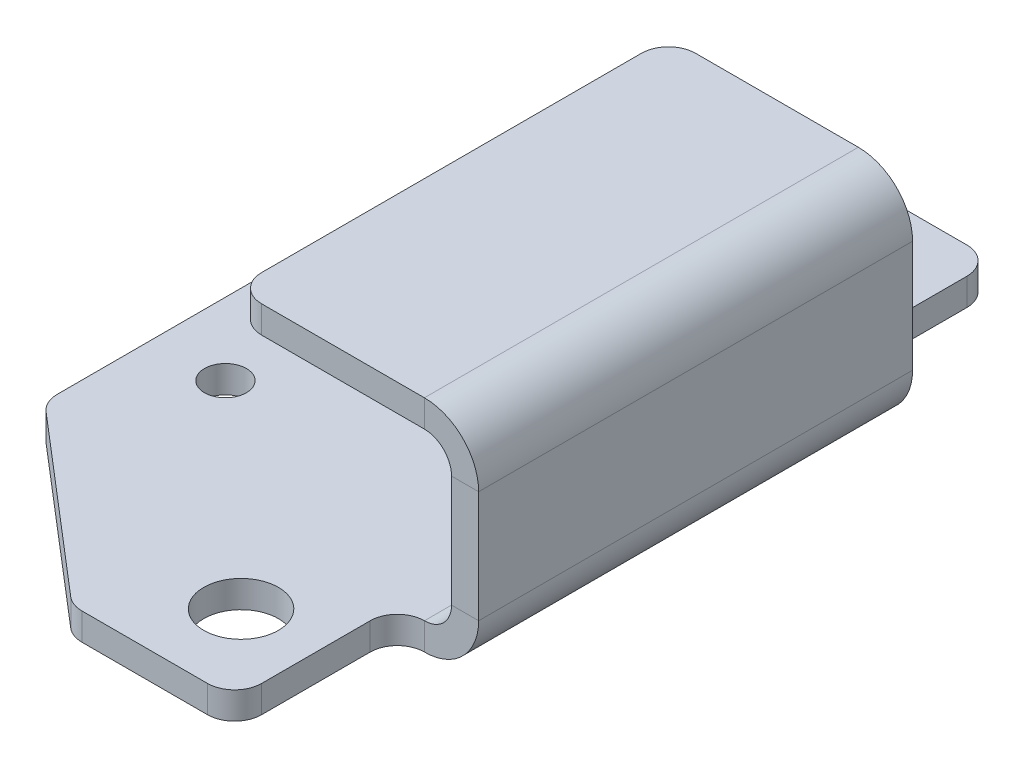
from build123d import *

# Parameters (mm, degrees)
BASE_FLANGE1_DEPTH  = 25.4
SKETCH7_W           = 41.275
SKETCH7_H           = 19.05
BOSS_EXTRUDE1_DEPTH = 3.175
SKETCH6_R           = 2.45745
SKETCH6_R_2         = 4.3688
CUT_EXTRUDE1_DEPTH  = 58.474902009
CUT_EXTRUDE2_DEPTH  = 58.474902009
FILLET1_R           = 3.175


# Sheet-metal steps are written as plain solids
with BuildPart() as part:
    # Sketch1 → Base-Flange1 (new, symmetric)
    with BuildSketch(Plane.XY):
        with BuildLine():
            Line((0, 0), (22.225, 0))
            ThreePointArc((22.225, 0), (24.47006403, -0.92993597), (25.4, -3.175))
            Line((25.4, -3.175), (25.4, -16.256))
            ThreePointArc((25.4, -16.256), (24.47006403, -18.50106403), (22.225, -19.431))
            Line((22.225, -19.431), (-22.225, -19.431))
            Line((-22.225, -19.431), (-22.225, -22.606))
            Line((-22.225, -22.606), (22.225, -22.606))
            ThreePointArc((22.225, -22.606), (26.715128061, -20.746128061), (28.575, -16.256))
            Line((28.575, -16.256), (28.575, -3.175))
            ThreePointArc((28.575, -3.175), (26.715128061, 1.315128061), (22.225, 3.175))
            Line((22.225, 3.175), (0, 3.175))
            Line((0, 3.175), (0, 0))
        make_face()
    extrude(amount=BASE_FLANGE1_DEPTH, both=True)

    # Sketch7 → Boss-Extrude1 (add)
    with BuildSketch(Plane.XZ.offset(22.606)):
        with Locations((-1.5875, 34.925)):
            Rectangle(SKETCH7_W, SKETCH7_H)
        with Locations((-1.5875, -34.925)):
            Rectangle(SKETCH7_W, SKETCH7_H)
    extrude(amount=-BOSS_EXTRUDE1_DEPTH)

    # Sketch6 → Cut-Extrude1 (cut, through all)
    with BuildSketch(Plane(origin=(0, -19.431, 0), x_dir=(1, 0, 0), z_dir=(0, 1, 0))):
        with Locations(Location((-13.7668, 12.7, 0), (0, 0, 180))):
            Circle(SKETCH6_R)
        with Locations(Location((-13.7668, -12.7, 0), (0, 0, 180))):
            Circle(SKETCH6_R)
        with Locations(Location((10.287, -34.925, 0), (0, 0, 180))):
            Circle(SKETCH6_R_2)
        with Locations(Location((10.287, 34.925, 0), (0, 0, 180))):
            Circle(SKETCH6_R_2)
    extrude(amount=-CUT_EXTRUDE1_DEPTH, mode=Mode.SUBTRACT)

    # Sketch8 → Cut-Extrude2 (cut, through all)
    with BuildSketch(Plane(origin=(0, -19.431, 0), x_dir=(1, 0, 0), z_dir=(0, 1, 0))):
        Polygon((0, -44.45), (-22.225, -25.4), (-22.225, -44.45), align=None)
        Polygon((-22.225, 44.45), (-22.225, 25.4), (0, 44.45), align=None)
    extrude(amount=-CUT_EXTRUDE2_DEPTH, mode=Mode.SUBTRACT)

    # Fillet1
    fillet1_edges = [part.edges().sort_by_distance(p)[0] for p in [
        (-22.225, -21.0185, 25.4),
        (0, -21.0185, 44.45),
        (-22.225, -21.0185, -25.4),
        (0, -21.0185, -44.45),
        (0, 1.5875, -25.4),
        (0, 1.5875, 25.4),
        (19.05, -21.0185, 44.45),
        (19.05, -21.0185, 25.4),
        (19.05, -21.0185, -25.4),
        (19.05, -21.0185, -44.45),
    ]]
    fillet(fillet1_edges, radius=FILLET1_R)


solid = part.part
